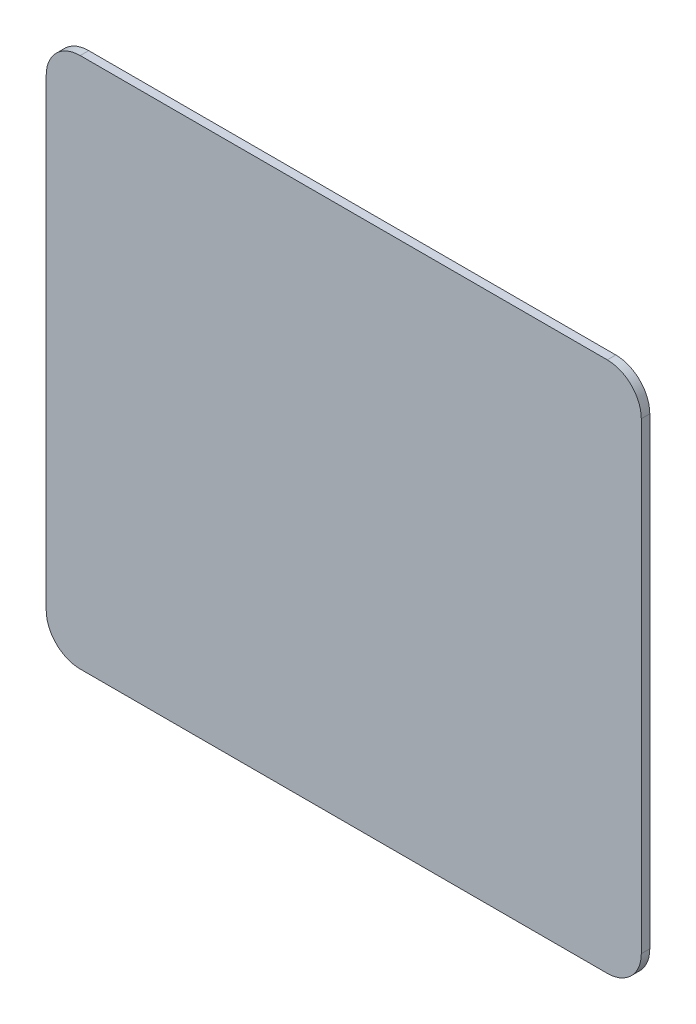
from build123d import *

# Parameters (mm, degrees)
BOSS_EXTRUDE1_DEPTH = 4


with BuildPart() as part:
    # Sketch1 → Boss-Extrude1 (new body)
    with BuildSketch(Plane.XY):
        with BuildLine():
            Line((-124, 125), (124, 125))
            ThreePointArc((124, 125), (135.313708499, 120.313708499), (140, 109))
            Line((140, 109), (140, -109))
            ThreePointArc((140, -109), (135.313708499, -120.313708499), (124, -125))
            Line((124, -125), (-124, -125))
            ThreePointArc((-124, -125), (-135.313708499, -120.313708499), (-140, -109))
            Line((-140, -109), (-140, 109))
            ThreePointArc((-140, 109), (-135.313708499, 120.313708499), (-124, 125))
        make_face()
    extrude(amount=BOSS_EXTRUDE1_DEPTH)


solid = part.part
